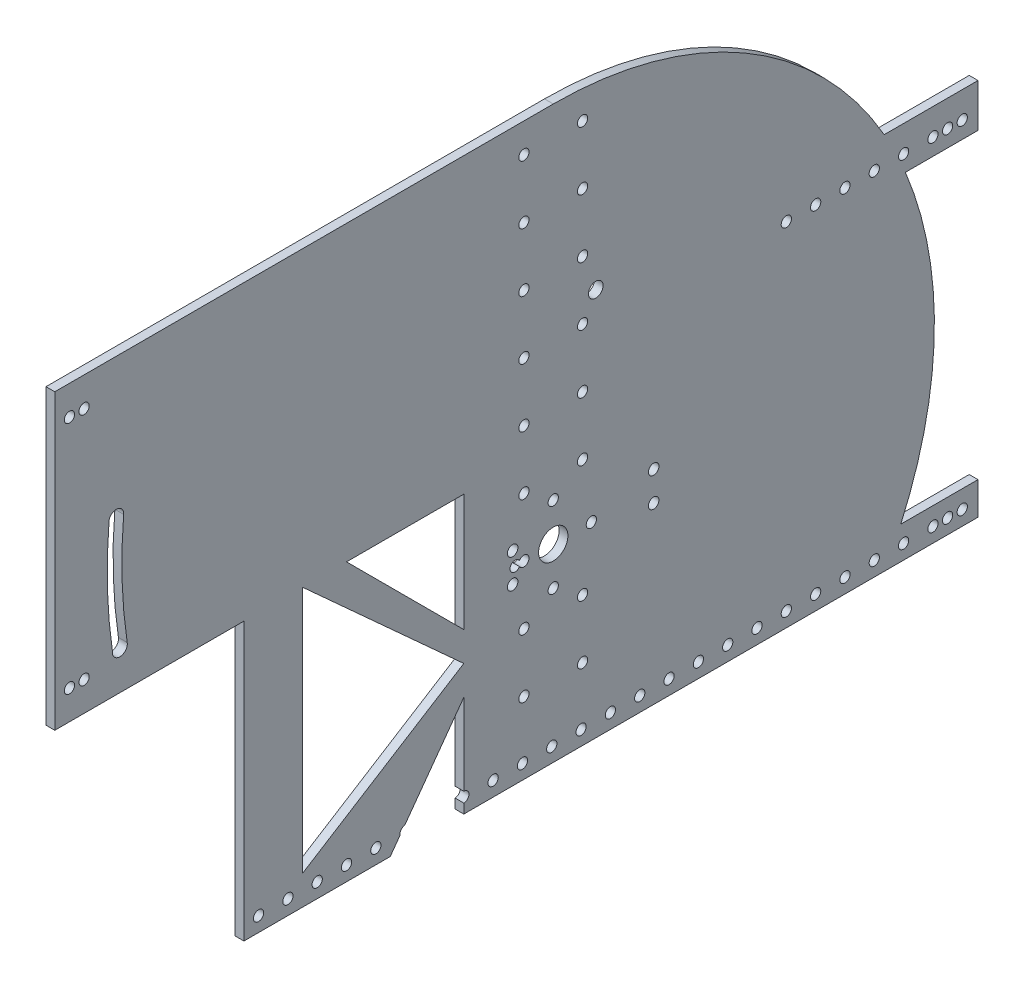
from build123d import *

# Parameters (mm, degrees)
SKETCH1_R           = 5
BOSS_EXTRUDE1_DEPTH = 3
SKETCH2_R           = 1.8
SKETCH2_R_2         = 1.75
SERVOHOLE_DEPTH     = 215.030371677
SKETCH3_W           = 322.70302131
SKETCH3_H           = 65.5
CUT_EXTRUDE2_DEPTH  = 215.030371677
SKETCH4_W           = 64.5
SKETCH4_H           = 115
CUT_EXTRUDE5_DEPTH  = 215.030371677
SKETCH5_R           = 1.75
CUT_EXTRUDE6_DEPTH  = 10
LPATTERN1_COUNT     = 14
LPATTERN1_PITCH     = 10
LPATTERN2_COUNT     = 14
LPATTERN2_PITCH     = 10
SKETCH6_R           = 1.75
CUT_EXTRUDE7_DEPTH  = 10
BOSS_EXTRUDE2_START = -3
SKETCH7_R           = 1.75
BOSS_EXTRUDE2_DEPTH = 3
SKETCH8_R           = 2.5
CUT_EXTRUDE8_DEPTH  = 3
SKETCH9_R           = 1.75
CUT_EXTRUDE9_DEPTH  = 10
SKETCH10_R          = 1.75
CUT_EXTRUDE10_DEPTH = 10


with BuildPart() as part:
    # Sketch1 → Boss-Extrude1 (new body)
    with BuildSketch(Plane(origin=(0, 0, 0), x_dir=(0, 0, -1), z_dir=(1, 0, 0))):
        with BuildLine():
            Line((0, 130), (-170, 130))
            Line((-170, 130), (-170, 30))
            Line((-170, 30), (-126.491106407, 30))
            ThreePointArc((-126.491106407, 30), (80.622577483, -101.980390272), (0, 130))
        make_face()
        Circle(SKETCH1_R, mode=Mode.SUBTRACT)
    extrude(amount=BOSS_EXTRUDE1_DEPTH)

    # Sketch2 → ServoHole (cut, through all)
    with BuildSketch(Plane(origin=(3, 0, 0), x_dir=(0, 0, -1), z_dir=(1, 0, 0))):
        with Locations((-13.85, 5)):
            Circle(SKETCH2_R)
        with Locations((-13.85, -5)):
            Circle(SKETCH2_R)
        with Locations((34.25, 5)):
            Circle(SKETCH2_R)
        with Locations((34.25, -5)):
            Circle(SKETCH2_R)
        with Locations((0, 13)):
            Circle(SKETCH2_R_2)
        with Locations((13, 0)):
            Circle(SKETCH2_R_2)
        with Locations((0, -13)):
            Circle(SKETCH2_R_2)
        with Locations((-13, 0)):
            Circle(SKETCH2_R_2)
    extrude(amount=-SERVOHOLE_DEPTH, mode=Mode.SUBTRACT)

    # Sketch3 → Cut-Extrude2 (cut, through all)
    with BuildSketch(Plane(origin=(3, 0, 0), x_dir=(0, 0, -1), z_dir=(1, 0, 0))):
        with Locations((-37.404207891, -97.25)):
            Rectangle(SKETCH3_W, SKETCH3_H)
    extrude(amount=-CUT_EXTRUDE2_DEPTH, mode=Mode.SUBTRACT)

    # Sketch4 → Cut-Extrude5 (cut, through all)
    with BuildSketch(Plane(origin=(3, 0, 0), x_dir=(0, 0, -1), z_dir=(1, 0, 0))):
        with Locations((-137.75, -27.5)):
            Rectangle(SKETCH4_W, SKETCH4_H)
        Polygon((-30.5, 30), (-30.5, -10), (-70.5, 30), align=None)
        Polygon((-85.5, 30), (-30.5, -20), (-85.5, -54.5), align=None)
        Polygon((-30.5, -30), (-70.5, -85), (-30.5, -85), align=None)
    extrude(amount=-CUT_EXTRUDE5_DEPTH, mode=Mode.SUBTRACT)

    # Sketch5 → Cut-Extrude6 (cut)
    with BuildSketch(Plane(origin=(3, 0, 0), x_dir=(0, 0, -1), z_dir=(1, 0, 0))):
        with Locations((-20.5, -59.5)):
            Circle(SKETCH5_R)
    cut_extrude6 = extrude(amount=-CUT_EXTRUDE6_DEPTH, mode=Mode.SUBTRACT)

    # LPattern1: Cut-Extrude6 ×14
    with Locations(*[(0, 0, -i * LPATTERN1_PITCH) for i in range(1, LPATTERN1_COUNT)]):
        add(cut_extrude6, mode=Mode.SUBTRACT)

    # LPattern2: Cut-Extrude6 ×14
    with Locations(*[(0, 0, i * LPATTERN2_PITCH) for i in range(1, LPATTERN2_COUNT)]):
        add(cut_extrude6, mode=Mode.SUBTRACT)

    # Sketch6 → Cut-Extrude7 (cut)
    with BuildSketch(Plane(origin=(3, 0, 0), x_dir=(0, 0, -1), z_dir=(1, 0, 0))):
        with Locations((109.5, 55.5)):
            Circle(SKETCH6_R)
        with Locations((99.5, 55.5)):
            Circle(SKETCH6_R)
        with Locations((89.5, 55.5)):
            Circle(SKETCH6_R)
        with Locations((79.5, 55.5)):
            Circle(SKETCH6_R)
    extrude(amount=-CUT_EXTRUDE7_DEPTH, mode=Mode.SUBTRACT)

    # Sketch7 → Boss-Extrude2 (add)
    # profile 1 of 2: a face of its own
    with BuildSketch(Plane(origin=(3, 0, 0), x_dir=(0, 0, -1), z_dir=(1, 0, 0)).offset(BOSS_EXTRUDE2_START)):
        with BuildLine():
            Line((112.870501018, -64.5), (144.870501018, -64.5))
            Line((144.870501018, -64.5), (144.870501018, -53.383029617))
            Line((144.870501018, -53.383029617), (118.533759533, -53.383029617))
            ThreePointArc((118.533759533, -53.383029617), (115.835571859, -59.009493238), (112.870501018, -64.5))
        make_face()
        with Locations((119.5, -59.5)):
            Circle(SKETCH7_R, mode=Mode.SUBTRACT)
        with Locations((129.5, -59.5)):
            Circle(SKETCH7_R, mode=Mode.SUBTRACT)
        with Locations((139.5, -59.5)):
            Circle(SKETCH7_R, mode=Mode.SUBTRACT)
        with Locations((134.5, -59.5)):
            Circle(SKETCH7_R, mode=Mode.SUBTRACT)
    # profile 2 of 2: a face of its own
    with BuildSketch(Plane(origin=(3, 0, 0), x_dir=(0, 0, -1), z_dir=(1, 0, 0)).offset(BOSS_EXTRUDE2_START)):
        with BuildLine():
            Line((112.870501018, 64.5), (144.870501018, 64.5))
            Line((144.870501018, 64.5), (144.870501018, 49.754581271))
            Line((144.870501018, 49.754581271), (120.101963525, 49.754581271))
            ThreePointArc((120.101963525, 49.754581271), (116.719317819, 57.241600675), (112.870501018, 64.5))
        make_face()
        with Locations((119.5, 55.5)):
            Circle(SKETCH7_R, mode=Mode.SUBTRACT)
        with Locations((129.5, 55.5)):
            Circle(SKETCH7_R, mode=Mode.SUBTRACT)
        with Locations((139.5, 55.5)):
            Circle(SKETCH7_R, mode=Mode.SUBTRACT)
        with Locations((134.5, 55.5)):
            Circle(SKETCH7_R, mode=Mode.SUBTRACT)
    extrude(amount=BOSS_EXTRUDE2_DEPTH)

    # Sketch8 → Cut-Extrude8 (cut)
    with BuildSketch(Plane.ZY):
        with Locations((-14.5, 67.89)):
            Circle(SKETCH8_R)
        with BuildLine():
            ThreePointArc((146.515496678, 82.033656727), (147.054309045, 62.76765435), (145.296085194, 43.574483293))
            ThreePointArc((145.296085194, 43.574483293), (147.823984799, 40.632816994), (150.351884405, 43.574483293))
            ThreePointArc((150.351884405, 43.574483293), (152.056813165, 62.769830784), (151.534168528, 82.033656727))
            ThreePointArc((151.534168528, 82.033656727), (149.024832603, 84.773075908), (146.515496678, 82.033656727))
        make_face()
    extrude(amount=-CUT_EXTRUDE8_DEPTH, mode=Mode.SUBTRACT)

    # Sketch9 → Cut-Extrude9 (cut)
    with BuildSketch(Plane.ZY):
        with Locations((160, 40)):
            Circle(SKETCH9_R)
        with Locations((160, 120)):
            Circle(SKETCH9_R)
        with Locations((165, 40)):
            Circle(SKETCH9_R)
        with Locations((165, 120)):
            Circle(SKETCH9_R)
    extrude(amount=-CUT_EXTRUDE9_DEPTH, mode=Mode.SUBTRACT)

    # Sketch10 → Cut-Extrude10 (cut)
    with BuildSketch(Plane.ZY):
        with Locations((10, 120)):
            Circle(SKETCH10_R)
        with Locations((10, 100)):
            Circle(SKETCH10_R)
        with Locations((10, 80)):
            Circle(SKETCH10_R)
        with Locations((10, 60)):
            Circle(SKETCH10_R)
        with Locations((10, 40)):
            Circle(SKETCH10_R)
        with Locations((10, 20)):
            Circle(SKETCH10_R)
        with Locations((10, 0)):
            Circle(SKETCH10_R)
        with Locations((10, -20)):
            Circle(SKETCH10_R)
        with Locations((10, -40)):
            Circle(SKETCH10_R)
        with Locations((-10, 20)):
            Circle(SKETCH10_R)
        with Locations((-10, -20)):
            Circle(SKETCH10_R)
        with Locations((-10, -40)):
            Circle(SKETCH10_R)
        with Locations((-10, 40)):
            Circle(SKETCH10_R)
        with Locations((-10, 60)):
            Circle(SKETCH10_R)
        with Locations((-10, 80)):
            Circle(SKETCH10_R)
        with Locations((-10, 100)):
            Circle(SKETCH10_R)
        with Locations((-10, 120)):
            Circle(SKETCH10_R)
    extrude(amount=-CUT_EXTRUDE10_DEPTH, mode=Mode.SUBTRACT)


solid = part.part
